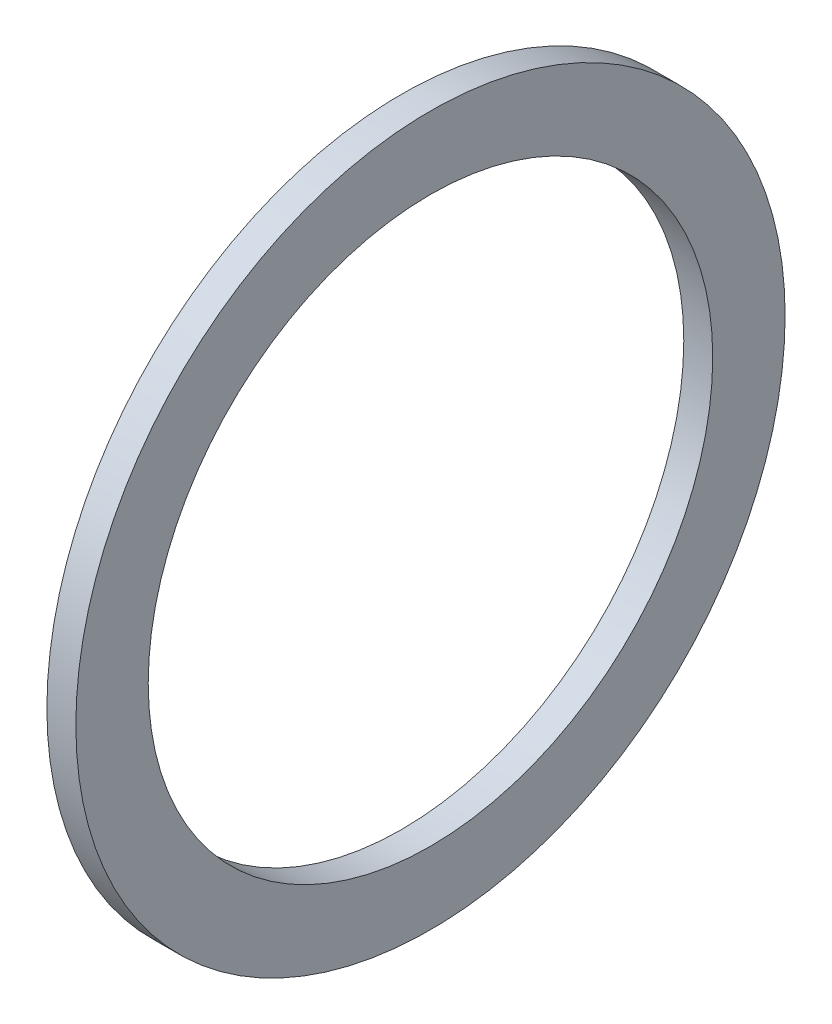
from build123d import *

# Parameters (mm, degrees)
SKETCH_1_R      = 24.5
SKETCH_1_R_2    = 19.5
EXTRUDE_1_DEPTH = 2


with BuildPart() as part:
    # Эскиз1 → Бобышка-Вытянуть1 (new body)
    with BuildSketch(Plane(origin=(0, 0, 0), x_dir=(0, 0, -1), z_dir=(1, 0, 0))):
        Circle(SKETCH_1_R)
        Circle(SKETCH_1_R_2, mode=Mode.SUBTRACT)
    extrude(amount=EXTRUDE_1_DEPTH)


solid = part.part
